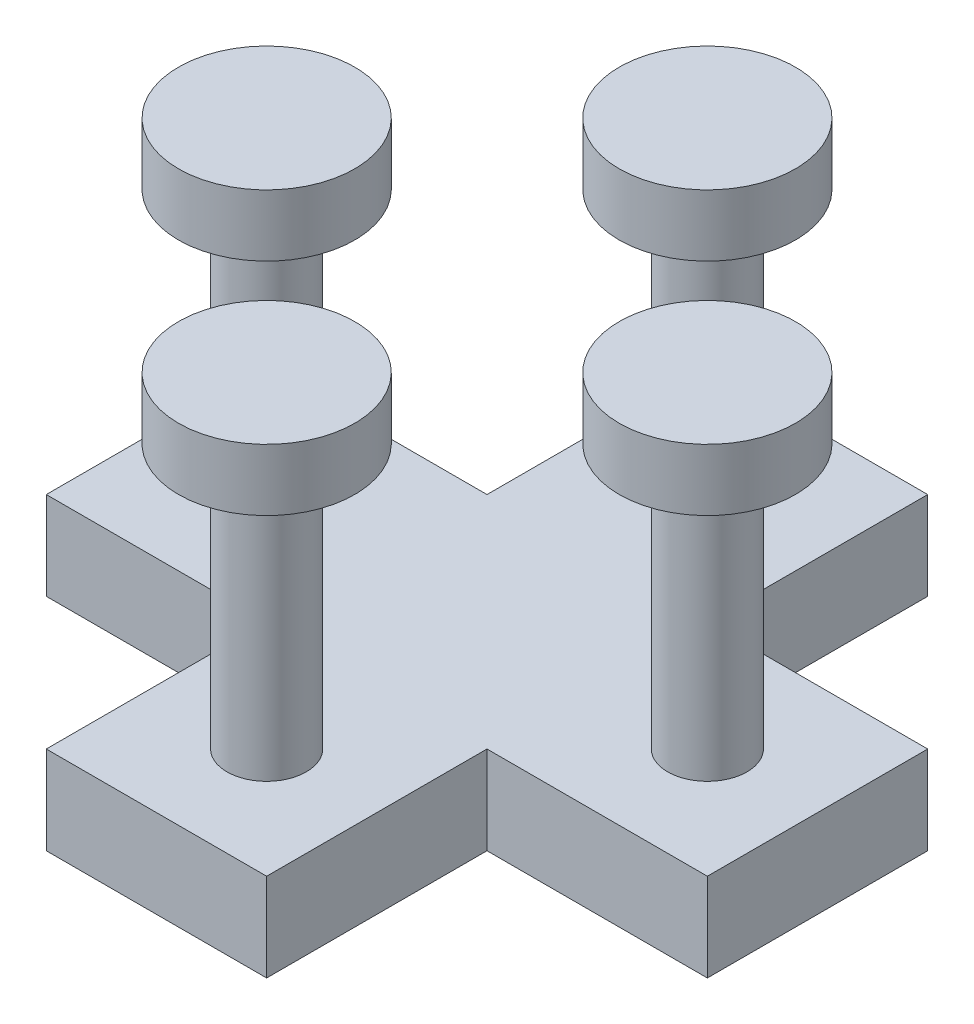
from build123d import *

# Parameters (mm, degrees)
BODY_DEPTH = 2.54
SKETCH2_R  = 1.143
PEGS_DEPTH = 7.62
SKETCH3_R  = 2.54
FEET_DEPTH = 1.778


with BuildPart() as part:
    # Sketch1 → body (new body)
    with BuildSketch(Plane(origin=(0, 0, 0), x_dir=(1, 0, 0), z_dir=(0, 1, 0))):
        Polygon((-8.348684361, -10.452067183), (-8.348684361, -4.102067183), (-1.998684361, -4.102067183), (-1.998684361, -10.452067183), (4.351315639, -10.452067183), (4.351315639, -16.802067183), (-1.998684361, -16.802067183), (-1.998684361, -23.152067183), (-8.348684361, -23.152067183), (-8.348684361, -16.802067183), (-14.698684361, -16.802067183), (-14.698684361, -10.452067183), align=None)
    extrude(amount=BODY_DEPTH)

    # Sketch2 → pegs (add)
    with BuildSketch(Plane(origin=(0, 2.54, 0), x_dir=(1, 0, 0), z_dir=(0, 1, 0))):
        with Locations((-5.173684361, -7.277067183)):
            Circle(SKETCH2_R)
        with Locations((1.176315639, -13.627067183)):
            Circle(SKETCH2_R)
        with Locations((-5.173684361, -19.977067183)):
            Circle(SKETCH2_R)
        with Locations((-11.523684361, -13.627067183)):
            Circle(SKETCH2_R)
    extrude(amount=PEGS_DEPTH)

    # Sketch3 → feet (add)
    with BuildSketch(Plane(origin=(0, 10.16, 0), x_dir=(1, 0, 0), z_dir=(0, 1, 0))):
        with Locations((-5.173684361, -7.277067183)):
            Circle(SKETCH3_R)
        with Locations((-11.523684361, -13.627067183)):
            Circle(SKETCH3_R)
        with Locations((-5.173684361, -19.977067183)):
            Circle(SKETCH3_R)
        with Locations((1.176315639, -13.627067183)):
            Circle(SKETCH3_R)
    extrude(amount=FEET_DEPTH)


solid = part.part
